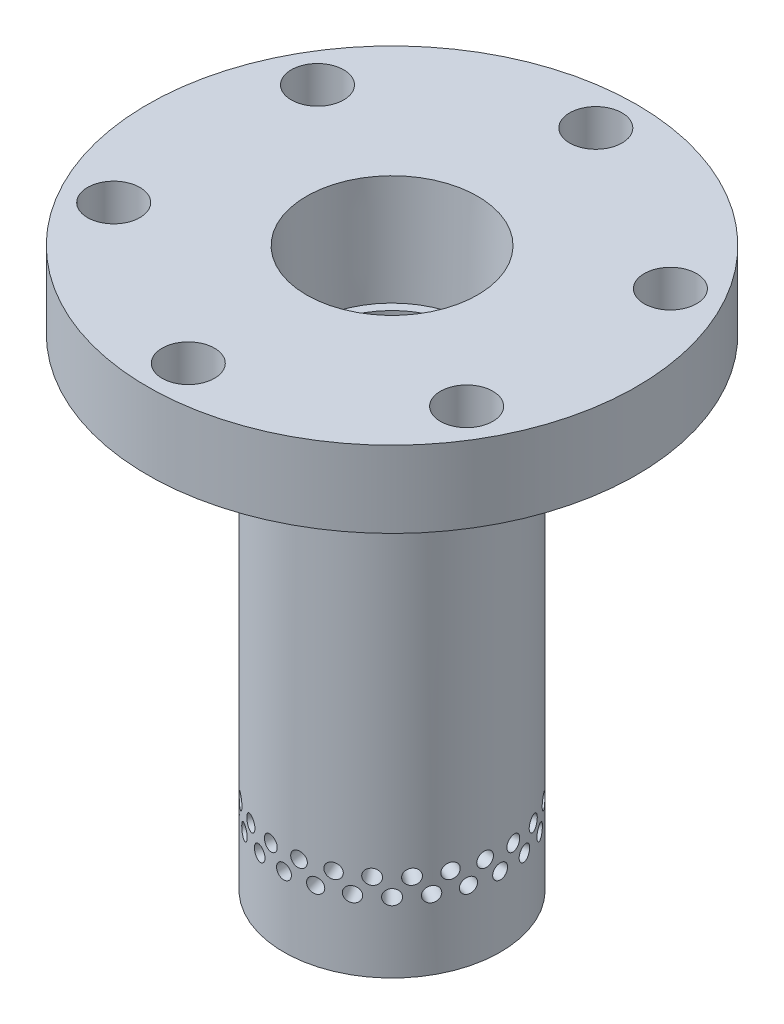
from build123d import *

# Parameters (mm, degrees)
F_1_4_CLEARANCE_HOLE1_D     = 6.5278
F_1_4_CLEARANCE_HOLE1_DEPTH = 22.606
F_1_4_CLEARANCE_HOLE1_TIP   = 1.961148974
CHAMFER1_SIZE               = 1
SKETCH6_R                   = 0.9271
CUT_EXTRUDE_49_DEPTH        = 82.803339938
CIRPATTERN1_COUNT           = 24
SKETCH7_R                   = 0.9271
CUT_EXTRUDE_49_2_DEPTH      = 82.803340023
CIRPATTERN2_COUNT           = 24


with BuildPart() as part:
    # Sketch1 → Revolve1 (revolve)
    with BuildSketch(Plane.XY):
        Polygon((0, 0), (-30.48, 0), (-30.48, -9.525), (-21, -9.525), (-21, -7.775), (-18, -7.775), (-18, -9.525), (-13.5, -9.525), (-13.5, -69.525), (0, -69.525), align=None)
    revolve(axis=Axis((0, 0, 0), (0, 1, 0)))

    # Sketch3 → 1/2 NPT Tapped Hole1 (revolve, cut)
    with BuildSketch(Plane(origin=(0, 0, 0), x_dir=(0, 0, 1), z_dir=(1, 0, 0))):
        Polygon((0, 0), (0, 66.010993174), (9.128125, 62.23), (9.128125, 13.462), (10.261665792, 13.462), (10.6647361, 0), align=None)
    revolve(axis=Axis((0, 6.35, 0), (0, -1, 0)), mode=Mode.SUBTRACT)

    # 1/4 Clearance Hole1
    with Locations(Plane(origin=(0, 0, 0), x_dir=(1, 0, 0), z_dir=(0, 1, 0))):
        with Locations((21.997045256, 12.7), (0, 25.4), (-21.997045256, 12.7), (-21.997045256, -12.7), (0, -25.4), (21.997045256, -12.7)):
            Hole(F_1_4_CLEARANCE_HOLE1_D / 2, depth=F_1_4_CLEARANCE_HOLE1_DEPTH)
            with Locations((0, 0, -(F_1_4_CLEARANCE_HOLE1_DEPTH + F_1_4_CLEARANCE_HOLE1_TIP / 2))):  # 118° drill point
                Cone(0, F_1_4_CLEARANCE_HOLE1_D / 2, F_1_4_CLEARANCE_HOLE1_TIP, mode=Mode.SUBTRACT)

    # Chamfer1
    chamfer1_edges = [part.edges().sort_by_distance(p)[0] for p in [
        (13.5, -9.525, 0),
    ]]
    chamfer(chamfer1_edges, length=CHAMFER1_SIZE)

    # Sketch6 → #49 (cut, through all)
    with BuildSketch(Plane.XY):
        with Locations((0, -60.7949)):
            Circle(SKETCH6_R)
    cut_extrude_49 = extrude(amount=-CUT_EXTRUDE_49_DEPTH, mode=Mode.SUBTRACT)

    # CirPattern1: #49 ×24 about axis
    cirpattern1_axis = Axis((0, 0, 0), (0, -1, 0))
    for i in range(1, CIRPATTERN1_COUNT):
        add(cut_extrude_49.rotate(cirpattern1_axis, i * 360 / CIRPATTERN1_COUNT), mode=Mode.SUBTRACT)

    # Sketch7 → #49-2 (cut, through all)
    with BuildSketch(Plane(origin=(0, 0, 0), x_dir=(0, -1, 0), z_dir=(0.9914448613738104, 0, 0.13052619222005188))):
        with Locations((58.674, 0)):
            Circle(SKETCH7_R)
    cut_extrude_49_2 = extrude(amount=-CUT_EXTRUDE_49_2_DEPTH, mode=Mode.SUBTRACT)

    # CirPattern2: #49-2 ×24 about axis
    cirpattern2_axis = Axis((0, 0, 0), (0, -1, 0))
    for i in range(1, CIRPATTERN2_COUNT):
        add(cut_extrude_49_2.rotate(cirpattern2_axis, i * 360 / CIRPATTERN2_COUNT), mode=Mode.SUBTRACT)


solid = part.part
